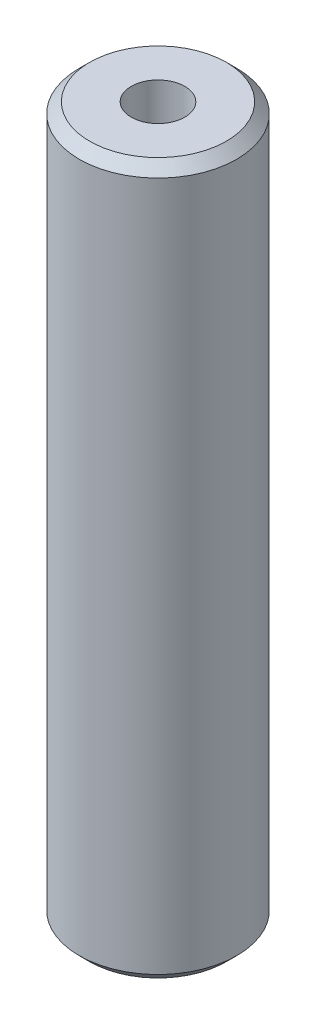
from build123d import *

# Parameters (mm, degrees)
SKETCH1_R           = 42.5
BOSS_EXTRUDE1_DEPTH = 383.328716125
SKETCH2_R           = 14.436970055
CUT_EXTRUDE1_DEPTH  = 389.012119148
CHAMFER1_SIZE       = 5.617524634


with BuildPart() as part:
    # Sketch1 → Boss-Extrude1 (new body)
    with BuildSketch(Plane(origin=(0, 0, 0), x_dir=(1, 0, 0), z_dir=(0, 1, 0))):
        Circle(SKETCH1_R)
    extrude(amount=BOSS_EXTRUDE1_DEPTH)

    # Sketch2 → Cut-Extrude1 (cut, through all)
    with BuildSketch(Plane(origin=(0, 0, 0), x_dir=(1, 0, 0), z_dir=(0, 1, 0))):
        Circle(SKETCH2_R)
    extrude(amount=CUT_EXTRUDE1_DEPTH, mode=Mode.SUBTRACT)

    # Chamfer1
    chamfer1_edges = [part.edges().sort_by_distance(p)[0] for p in [
        (-42.5, 383.328716125, 0),
        (-42.5, 0, 0),
    ]]
    chamfer(chamfer1_edges, length=CHAMFER1_SIZE)


solid = part.part
